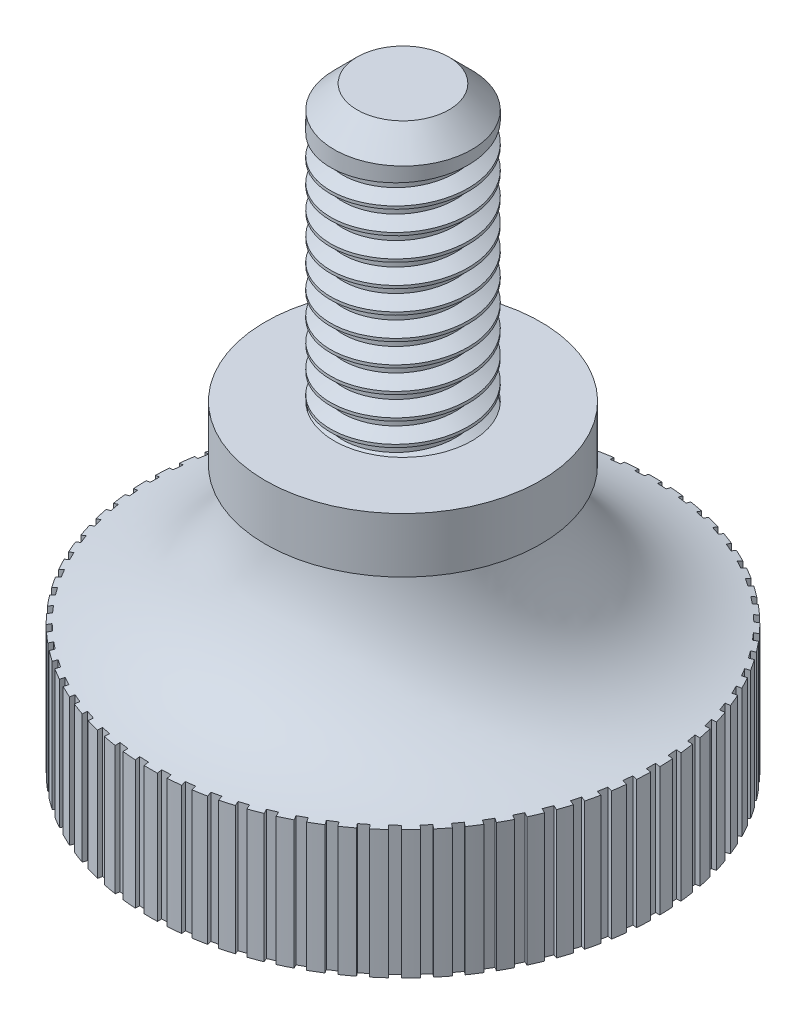
from build123d import *

# Parameters (mm, degrees)
SKETCH_1_R               = 5.5
EXTRUDE_1_DEPTH          = 2.8
SKETCH_4_R               = 3
EXTRUDE_2_DEPTH          = 1.2
SKETCH_5_R               = 1.5
EXTRUDE_3_DEPTH          = 6
CHAMFER_1_SIZE           = 0.5
THREAD_1_PITCH           = 0.5
SKETCH_6_W               = 0.627296808
SKETCH_6_H               = 0.2
CUT_EXTRUDE_1_DEPTH      = 10
PATTERN_CIRCULAR_1_COUNT = 70


with BuildPart() as part:
    # Sketch 1 → 凸台-拉伸1 (new body)
    with BuildSketch(Plane(origin=(0, 0, 0), x_dir=(1, 0, 0), z_dir=(0, 1, 0))):
        with Locations(Location((0, 0, 0), (0, 0, 270))):
            Circle(SKETCH_1_R)
    extrude(amount=EXTRUDE_1_DEPTH)

    # 草图3 → 旋转1 (revolve)
    with BuildSketch(Plane.XY):
        with BuildLine():
            Line((-2.6, 5.8), (0, 5.8))
            Line((0, 5.8), (0, 2.8))
            Line((0, 2.8), (-5.5, 2.8))
            add(Edge.make_bspline(
                [(-5.5, 2.8), (-2.988012802, 3.258502121), (-2.6, 5.8)],
                knots=[0, 0, 0, 1, 1, 1], degree=2))
        make_face()
    revolve(axis=Axis((0, 5.8, 0), (0, -1, 0)))

    # 草图4 → 凸台-拉伸2 (add)
    with BuildSketch(Plane(origin=(0, 5.8, 0), x_dir=(1, 0, 0), z_dir=(0, 1, 0))):
        with Locations(Location((0, 0, 0), (0, 0, 270))):
            Circle(SKETCH_4_R)
    extrude(amount=EXTRUDE_2_DEPTH)

    # 草图5 → 凸台-拉伸3 (add)
    with BuildSketch(Plane(origin=(0, 7, 0), x_dir=(1, 0, 0), z_dir=(0, 1, 0))):
        with Locations(Location((0, 0, 0), (0, 0, 270))):
            Circle(SKETCH_5_R)
    extrude(amount=EXTRUDE_3_DEPTH)

    # 倒角1
    chamfer_1_edges = [part.edges().sort_by_distance(p)[0] for p in [
        (0, 13, -1.5),
    ]]
    chamfer(chamfer_1_edges, length=CHAMFER_1_SIZE)

    # 螺纹线1: the profile of Sketch 1 2 profile screwed along a right-hand helix of 12 turns, 6 arcs to a turn; built about Z, then put on its axis
    thread_1_z = Axis((0, 0, 0), (0, 0, 1))
    thread_1_corners = [(1.5003, 0, -0.000173205), (1.5003, 0, 0.437673204), (1.229367063, 0, 0.281249999), (1.229367063, 0, 0.156249999)]
    with BuildLine(mode=Mode.PRIVATE) as thread_1_profile:
        Line(thread_1_corners[0], thread_1_corners[1])
        Line(thread_1_corners[1], thread_1_corners[2])
        Line(thread_1_corners[2], thread_1_corners[3])
        Line(thread_1_corners[3], thread_1_corners[0])
    thread_1_cap = Face(thread_1_profile.wire())
    thread_1_turn_angles = [0, 30, 60, 90, 120, 150, 180, 210, 240, 270, 300, 330, 360]
    thread_1_turn_weights = [1, 0.8660254037844387, 1, 0.8660254037844387, 1, 0.8660254037844387, 1, 0.8660254037844387, 1, 0.8660254037844387, 1, 0.8660254037844387, 1]
    thread_1_turn_rails = [Edge.make_bspline([Vector(p[0], p[1], 0).rotate(thread_1_z, thread_1_turn_angles[k]) / thread_1_turn_weights[k] + Vector(0, 0, p[2] + THREAD_1_PITCH * thread_1_turn_angles[k] / 360) for k in range(13)], [0, 0, 0, 1, 1, 2, 2, 3, 3, 4, 4, 5, 5, 6, 6, 6], 2, thread_1_turn_weights) for p in thread_1_corners]
    thread_1_turn_sides = [Face.make_surface_from_curves(thread_1_turn_rails[p[0]], thread_1_turn_rails[p[1]]) for p in [(0, 1), (1, 2), (2, 3), (3, 0)]]
    thread_1 = Plane(origin=(0, 12.5, 0), x_dir=(-1, 0, 0), z_dir=(0, -1, 0)) * Solid(Shell([*[p.moved(Location((0, 0, THREAD_1_PITCH * i))) for i in range(12) for p in thread_1_turn_sides], thread_1_cap, thread_1_cap.rotate(thread_1_z, 4320).moved(Location((0, 0, THREAD_1_PITCH * 4320 / 360)))]))
    add(thread_1, mode=Mode.SUBTRACT)

    # 草图6 → 切除-拉伸1 (cut)
    with BuildSketch(Plane(origin=(0, 0, 0), x_dir=(-1, 0, 0), z_dir=(0, -1, 0))):
        with Locations((5.72043702, 0)):
            Rectangle(SKETCH_6_W, SKETCH_6_H)
    cut_extrude_1 = extrude(amount=-CUT_EXTRUDE_1_DEPTH, mode=Mode.SUBTRACT)

    # 阵列(圆周)1: 切除-拉伸1 ×70 about axis
    pattern_circular_1_axis = Axis((0, 0, 0), (0, 1, 0))
    for i in range(1, PATTERN_CIRCULAR_1_COUNT):
        add(cut_extrude_1.rotate(pattern_circular_1_axis, i * 360 / PATTERN_CIRCULAR_1_COUNT), mode=Mode.SUBTRACT)


solid = part.part
